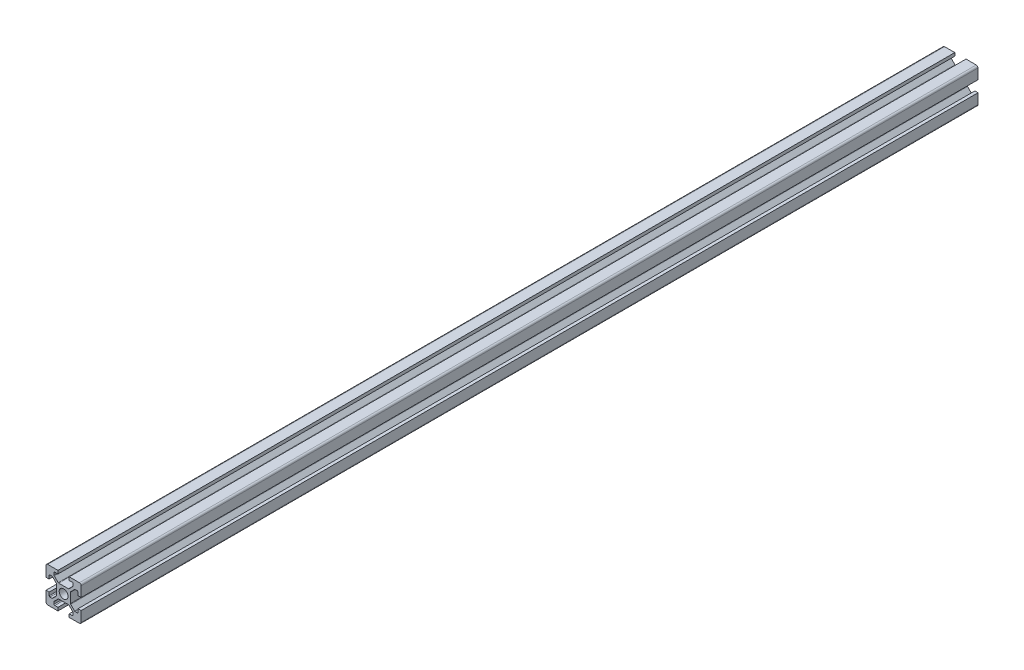
from build123d import *

# Parameters (mm, degrees)
SKETCH1_R           = 2.5
BOSS_EXTRUDE1_DEPTH = 510
FILLET1_R           = 1
FILLET2_R           = 0.5
FILLET3_R           = 0.5
FILLET4_R           = 0.5
FILLET5_R           = 0.5


with BuildPart() as part:
    # Sketch1 → Boss-Extrude1 (new body)
    with BuildSketch(Plane.XY):
        Polygon((0, 6.8), (0, 0), (6.8, 0), (6.8, 1.8), (4.55, 1.8), (4.55, 3.6), (7.05, 6.1), (12.95, 6.1), (15.45, 3.6), (15.45, 1.8), (13.2, 1.8), (13.2, 0), (20, 0), (20, 6.8), (18.2, 6.8), (18.2, 4.55), (16.4, 4.55), (13.9, 7.05), (13.9, 12.95), (16.4, 15.45), (18.2, 15.45), (18.2, 13.2), (20, 13.2), (20, 20), (13.2, 20), (13.2, 18.2), (15.45, 18.2), (15.45, 16.4), (12.95, 13.9), (7.05, 13.9), (4.55, 16.4), (4.55, 18.2), (6.8, 18.2), (6.8, 20), (0, 20), (0, 13.2), (1.8, 13.2), (1.8, 15.45), (3.6, 15.45), (6.1, 12.95), (6.1, 7.05), (3.6, 4.55), (1.8, 4.55), (1.8, 6.8), align=None)
        with Locations((10, 10)):
            Circle(SKETCH1_R, mode=Mode.SUBTRACT)
    extrude(amount=BOSS_EXTRUDE1_DEPTH)

    # Fillet1
    fillet1_edges = [part.edges().sort_by_distance(p)[0] for p in [
        (20, 20, 255),
        (20, 0, 255),
        (0, 0, 255),
        (0, 20, 255),
    ]]
    fillet(fillet1_edges, radius=FILLET1_R)

    # Fillet2
    fillet2_edges = [part.edges().sort_by_distance(p)[0] for p in [
        (4.55, 18.2, 255),
        (4.55, 16.4, 255),
        (7.05, 13.9, 255),
        (15.45, 18.2, 255),
        (15.45, 16.4, 255),
        (12.95, 13.9, 255),
    ]]
    fillet(fillet2_edges, radius=FILLET2_R)

    # Fillet3
    fillet3_edges = [part.edges().sort_by_distance(p)[0] for p in [
        (18.2, 15.45, 255),
        (16.4, 15.45, 255),
        (13.9, 12.95, 255),
        (18.2, 4.55, 255),
        (13.9, 7.05, 255),
        (16.4, 4.55, 255),
    ]]
    fillet(fillet3_edges, radius=FILLET3_R)

    # Fillet4
    fillet4_edges = [part.edges().sort_by_distance(p)[0] for p in [
        (1.8, 15.45, 255),
        (3.6, 15.45, 255),
        (6.1, 12.95, 255),
        (3.6, 4.55, 255),
        (1.8, 4.55, 255),
        (6.1, 7.05, 255),
    ]]
    fillet(fillet4_edges, radius=FILLET4_R)

    # Fillet5
    fillet5_edges = [part.edges().sort_by_distance(p)[0] for p in [
        (7.05, 6.1, 255),
        (4.55, 3.6, 255),
        (4.55, 1.8, 255),
        (15.45, 1.8, 255),
        (15.45, 3.6, 255),
        (12.95, 6.1, 255),
    ]]
    fillet(fillet5_edges, radius=FILLET5_R)


solid = part.part
